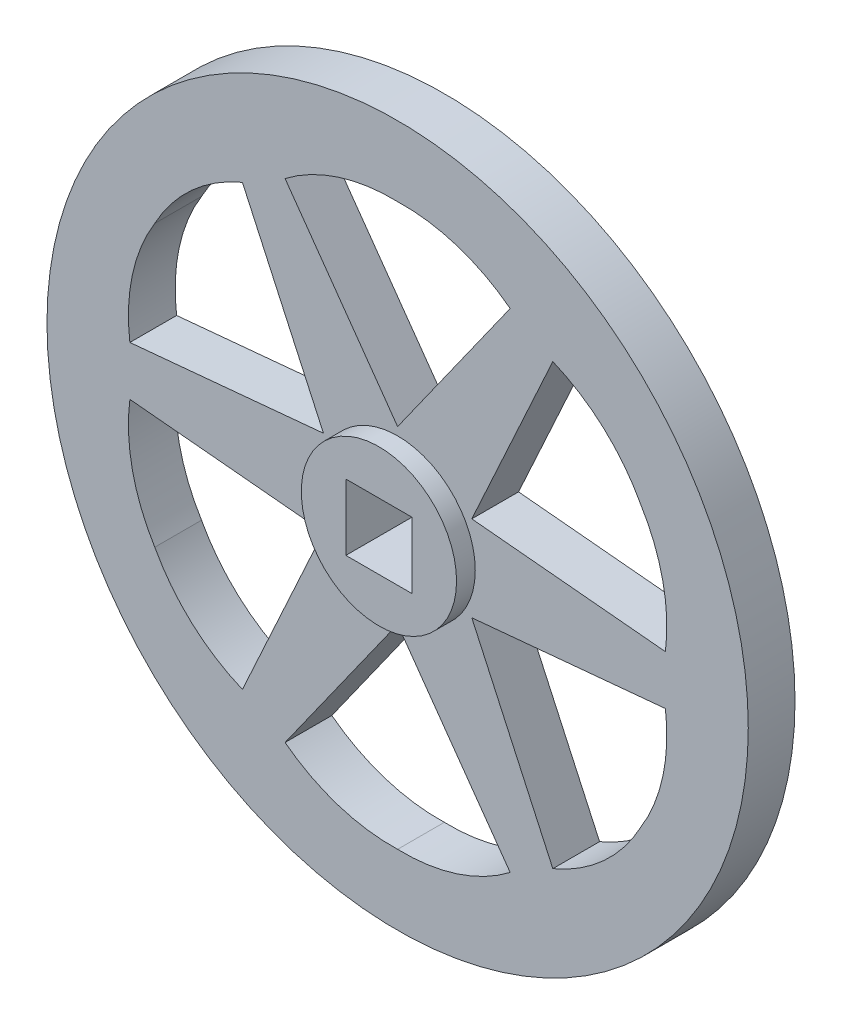
from build123d import *

# Parameters (mm, degrees)
SKETCH1_R           = 37.5
SKETCH1_W           = 7.071067812
SKETCH1_H           = 7.071067812
BOSS_EXTRUDE1_DEPTH = 2.5
CUT_EXTRUDE1_DEPTH  = 4
CIRPATTERN1_COUNT   = 6
SKETCH4_R           = 8.302662018
SKETCH4_W           = 7.071067812
SKETCH4_H           = 7.071067812
BOSS_EXTRUDE2_DEPTH = 2


with BuildPart() as part:
    # Sketch1 → Boss-Extrude1 (new, symmetric)
    with BuildSketch(Plane.XY):
        Circle(SKETCH1_R)
        Rectangle(SKETCH1_W, SKETCH1_H, mode=Mode.SUBTRACT)
    extrude(amount=BOSS_EXTRUDE1_DEPTH, both=True)

    # Sketch2 → Cut-Extrude1 (cut, symmetric)
    with BuildSketch(Plane.XY):
        with BuildLine():
            Line((0, 9.158641407), (-12.037071564, 26.115211784))
            ThreePointArc((-12.037071564, 26.115211784), (-6.351662121, 29.087034336), (0, 29.988143709))
            ThreePointArc((0, 29.988143709), (6.351662121, 29.087034336), (12.037071564, 26.115211784))
            Line((12.037071564, 26.115211784), (0, 9.158641407))
        make_face()
    cut_extrude1 = extrude(amount=CUT_EXTRUDE1_DEPTH, both=True, mode=Mode.SUBTRACT)

    # CirPattern1: Cut-Extrude1 ×6 about axis
    cirpattern1_axis = Axis((0, 0, 2.5), (0, 0, -1))
    for i in range(1, CIRPATTERN1_COUNT):
        add(cut_extrude1.rotate(cirpattern1_axis, i * 360 / CIRPATTERN1_COUNT), mode=Mode.SUBTRACT)

    # Sketch4 → Boss-Extrude2 (add)
    with BuildSketch(Plane.XY.offset(2.5)):
        Circle(SKETCH4_R)
        Rectangle(SKETCH4_W, SKETCH4_H, mode=Mode.SUBTRACT)
    extrude(amount=BOSS_EXTRUDE2_DEPTH)


solid = part.part
